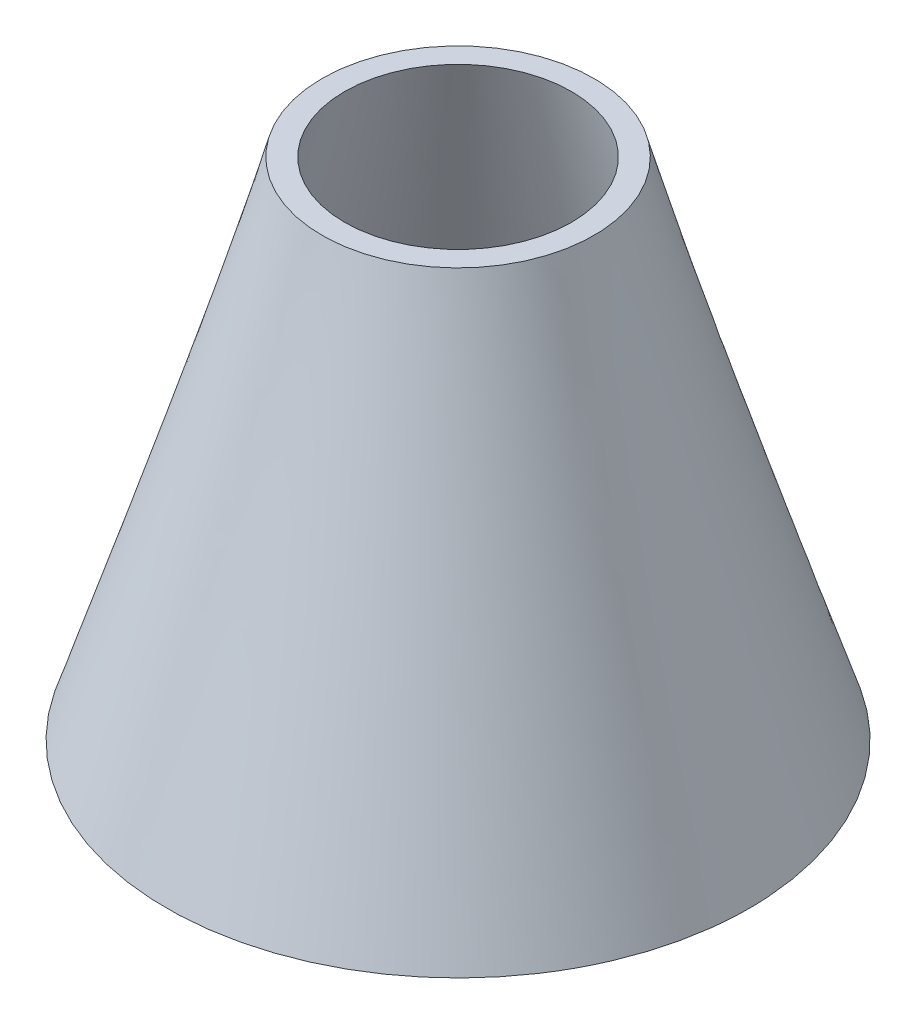
from build123d import *

# Parameters (mm, degrees)
SKETCH_7_R          = 32.5
CUT_EXTRUDE_6_DEPTH = 84.889808845
CUT_EXTRUDE_6_DRAFT = -15.4


with BuildPart() as part:
    # 放样6: read off the stored shape, not the designer's step
    # 放样6: loft between two sections, ruled curve by curve
    loft_6_from = [
        Edge.make_bspline([(-36.214074736, 0, -9.736056237), (-55.686187209, 0, 62.692093235), (16.741962262, 0, 82.164205708), (36.214074736, 0, 9.736056237), (55.686187209, 0, -62.692093235), (-16.741962262, 0, -82.164205708), (-36.214074736, 0, -9.736056237)], [0, 0, 0, 0, 0.5, 0.5, 0.5, 1, 1, 1, 1], 3, [1, 0.333333333, 0.333333333, 1, 0.333333333, 0.333333333, 1]),
    ]
    loft_6_to = [
        Edge.make_bspline([(-14.266859289, 65, -10.134432694), (-34.535724677, 65, 18.399285883), (-6.0020061, 65, 38.668151272), (14.266859289, 65, 10.134432694), (34.535724677, 65, -18.399285883), (6.0020061, 65, -38.668151272), (-14.266859289, 65, -10.134432694)], [0, 0, 0, 0, 0.5, 0.5, 0.5, 1, 1, 1, 1], 3, [1, 0.333333333, 0.333333333, 1, 0.333333333, 0.333333333, 1]),
    ]
    loft_6 = Solid(Shell([*[Face.make_surface_from_curves(loft_6_from[k], loft_6_to[k]) for k in range(1)], Face(Wire(loft_6_from)), Face(Wire(loft_6_to))]))
    add(loft_6)


with BuildPart() as cut_extrude_6_tool:
    # 草图7 → 切除-拉伸6 (with draft: the straight prism first)
    with BuildSketch(Plane(origin=(0, 0, 0), x_dir=(-1, 0, 0), z_dir=(0, -1, 0))):
        Circle(SKETCH_7_R)
    extrude(amount=-CUT_EXTRUDE_6_DEPTH)
    # 切除-拉伸6: the draft: its side faces are tilted about the plane it starts from
    cut_extrude_6_sides = [cut_extrude_6_tool.faces().sort_by_distance(p)[0] for p in [
        (32.5, 42.444904422, 0),
    ]]
    draft(cut_extrude_6_sides, Plane(origin=(0, 0, 0), x_dir=(-1, 0, 0), z_dir=(0, -1, 0)), CUT_EXTRUDE_6_DRAFT)


with BuildPart() as part_1:
    add(part.part)

    # 切除-拉伸6: cut by cut_extrude_6_tool
    add(cut_extrude_6_tool.part, mode=Mode.SUBTRACT)


solid = part_1.part
